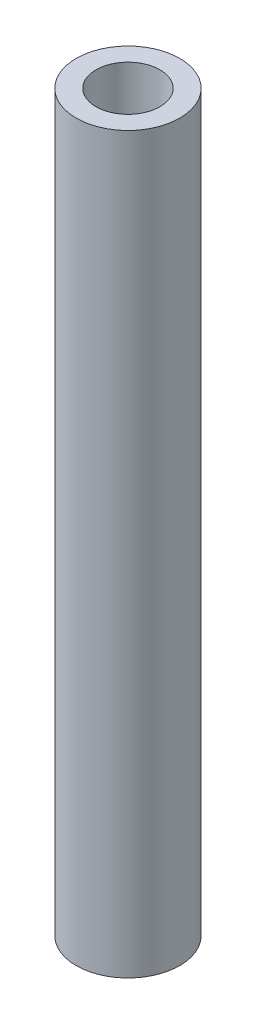
from build123d import *

# Parameters (mm, degrees)
SKETCH1_R           = 5.5
SKETCH1_R_2         = 2.58
BOSS_EXTRUDE1_DEPTH = 78
CUT_EXTRUDE2_START  = -65
SKETCH4_R           = 3.4
SKETCH4_R_2         = 2.58
CUT_EXTRUDE2_DEPTH  = 65


with BuildPart() as part:
    # Sketch1 → Boss-Extrude1 (new body)
    with BuildSketch(Plane(origin=(0, 0, 0), x_dir=(1, 0, 0), z_dir=(0, 1, 0))):
        Circle(SKETCH1_R)
        Circle(SKETCH1_R_2, mode=Mode.SUBTRACT)
    extrude(amount=BOSS_EXTRUDE1_DEPTH)

    # Sketch4 → Cut-Extrude2 (cut)
    with BuildSketch(Plane(origin=(0, 78, 0), x_dir=(1, 0, 0), z_dir=(0, 1, 0)).offset(CUT_EXTRUDE2_START)):
        Circle(SKETCH4_R)
        Circle(SKETCH4_R_2, mode=Mode.SUBTRACT)
    extrude(amount=CUT_EXTRUDE2_DEPTH, mode=Mode.SUBTRACT)


solid = part.part
